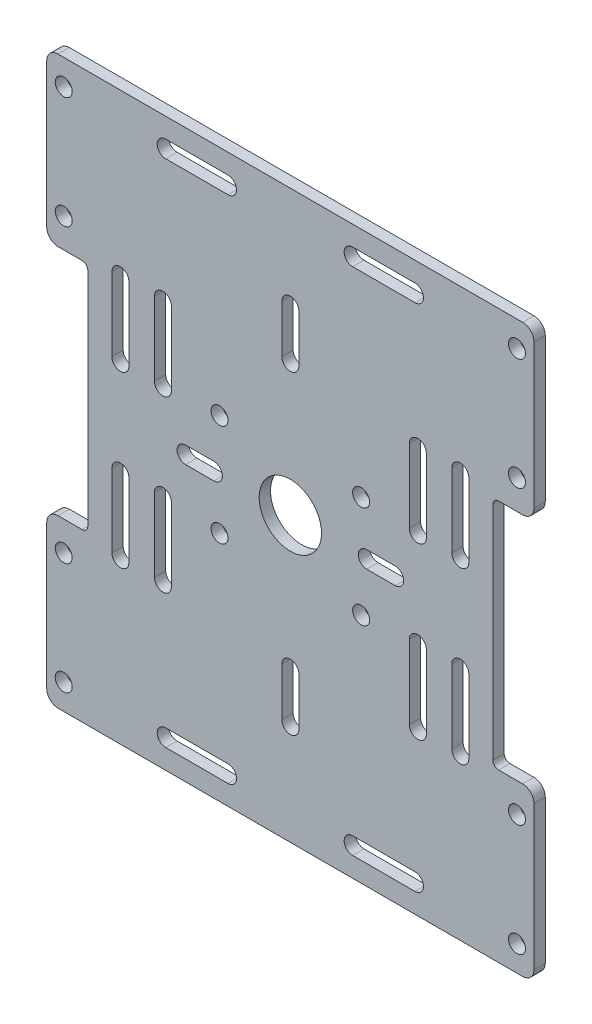
from build123d import *

# Parameters (mm, degrees)
SKETCH_1_R      = 5.5
SKETCH_1_R_2    = 1.5
EXTRUDE_1_DEPTH = 2
FILLET_1_R      = 1
FILLET_2_R      = 2


with BuildPart() as part:
    # 草圖1 → 填料-伸長1 (new body)
    with BuildSketch(Plane.XY):
        Polygon((-35.75, -20.56252042), (-43, -20.56252042), (-43, -50), (-25.75, -50), (25.75, -50), (43, -50), (43, -20.56252042), (35.75, -20.56252042), (35.75, 20.56252042), (43, 20.56252042), (43, 50), (25.75, 50), (-25.75, 50), (-43, 50), (-43, 20.56252042), (-35.75, 20.56252042), align=None)
        Circle(SKETCH_1_R, mode=Mode.SUBTRACT)
        with Locations((12.5, -9)):
            Circle(SKETCH_1_R_2, mode=Mode.SUBTRACT)
        with Locations((-12.5, -9)):
            Circle(SKETCH_1_R_2, mode=Mode.SUBTRACT)
        with Locations((12.5, 9)):
            Circle(SKETCH_1_R_2, mode=Mode.SUBTRACT)
        with Locations((-12.5, 9)):
            Circle(SKETCH_1_R_2, mode=Mode.SUBTRACT)
        with Locations((-40, -25.75)):
            Circle(SKETCH_1_R_2, mode=Mode.SUBTRACT)
        with Locations((40, -25.75)):
            Circle(SKETCH_1_R_2, mode=Mode.SUBTRACT)
        with Locations((40, 25.75)):
            Circle(SKETCH_1_R_2, mode=Mode.SUBTRACT)
        with Locations((-40, 25.75)):
            Circle(SKETCH_1_R_2, mode=Mode.SUBTRACT)
        with Locations((-40, -45.5)):
            Circle(SKETCH_1_R_2, mode=Mode.SUBTRACT)
        with Locations((-40, 45.5)):
            Circle(SKETCH_1_R_2, mode=Mode.SUBTRACT)
        with Locations((40, 45.5)):
            Circle(SKETCH_1_R_2, mode=Mode.SUBTRACT)
        with Locations((40, -45.5)):
            Circle(SKETCH_1_R_2, mode=Mode.SUBTRACT)
        with BuildLine():
            Line((13.5, 1.5), (18.5, 1.5))
            ThreePointArc((18.5, 1.5), (20, 0), (18.5, -1.5))
            Line((18.5, -1.5), (13.5, -1.5))
            ThreePointArc((13.5, -1.5), (12, 0), (13.5, 1.5))
        make_face(mode=Mode.SUBTRACT)
        with BuildLine():
            Line((24, -8.5), (24, -21.5))
            ThreePointArc((24, -21.5), (22.5, -23), (21, -21.5))
            Line((21, -21.5), (21, -8.5))
            ThreePointArc((21, -8.5), (22.5, -7), (24, -8.5))
        make_face(mode=Mode.SUBTRACT)
        with BuildLine():
            Line((31.5, -8.5), (31.5, -21.5))
            ThreePointArc((31.5, -21.5), (30, -23), (28.5, -21.5))
            Line((28.5, -21.5), (28.5, -8.5))
            ThreePointArc((28.5, -8.5), (30, -7), (31.5, -8.5))
        make_face(mode=Mode.SUBTRACT)
        with BuildLine():
            Line((31.5, 8.5), (31.5, 21.5))
            ThreePointArc((31.5, 21.5), (30, 23), (28.5, 21.5))
            Line((28.5, 21.5), (28.5, 8.5))
            ThreePointArc((28.5, 8.5), (30, 7), (31.5, 8.5))
        make_face(mode=Mode.SUBTRACT)
        with BuildLine():
            Line((24, 8.5), (24, 21.5))
            ThreePointArc((24, 21.5), (22.5, 23), (21, 21.5))
            Line((21, 21.5), (21, 8.5))
            ThreePointArc((21, 8.5), (22.5, 7), (24, 8.5))
        make_face(mode=Mode.SUBTRACT)
        with BuildLine():
            Line((-24, 8.5), (-24, 21.5))
            ThreePointArc((-24, 21.5), (-22.5, 23), (-21, 21.5))
            Line((-21, 21.5), (-21, 8.5))
            ThreePointArc((-21, 8.5), (-22.5, 7), (-24, 8.5))
        make_face(mode=Mode.SUBTRACT)
        with BuildLine():
            Line((-31.5, 8.5), (-31.5, 21.5))
            ThreePointArc((-31.5, 21.5), (-30, 23), (-28.5, 21.5))
            Line((-28.5, 21.5), (-28.5, 8.5))
            ThreePointArc((-28.5, 8.5), (-30, 7), (-31.5, 8.5))
        make_face(mode=Mode.SUBTRACT)
        with BuildLine():
            Line((-31.5, -8.5), (-31.5, -21.5))
            ThreePointArc((-31.5, -21.5), (-30, -23), (-28.5, -21.5))
            Line((-28.5, -21.5), (-28.5, -8.5))
            ThreePointArc((-28.5, -8.5), (-30, -7), (-31.5, -8.5))
        make_face(mode=Mode.SUBTRACT)
        with BuildLine():
            Line((-24, -8.5), (-24, -21.5))
            ThreePointArc((-24, -21.5), (-22.5, -23), (-21, -21.5))
            Line((-21, -21.5), (-21, -8.5))
            ThreePointArc((-21, -8.5), (-22.5, -7), (-24, -8.5))
        make_face(mode=Mode.SUBTRACT)
        with BuildLine():
            Line((-22, -43.5), (-11, -43.5))
            ThreePointArc((-11, -43.5), (-9.5, -45), (-11, -46.5))
            Line((-11, -46.5), (-22, -46.5))
            ThreePointArc((-22, -46.5), (-23.5, -45), (-22, -43.5))
        make_face(mode=Mode.SUBTRACT)
        with BuildLine():
            Line((22, -43.5), (11, -43.5))
            ThreePointArc((11, -43.5), (9.5, -45), (11, -46.5))
            Line((11, -46.5), (22, -46.5))
            ThreePointArc((22, -46.5), (23.5, -45), (22, -43.5))
        make_face(mode=Mode.SUBTRACT)
        with BuildLine():
            Line((22, 43.5), (11, 43.5))
            ThreePointArc((11, 43.5), (9.5, 45), (11, 46.5))
            Line((11, 46.5), (22, 46.5))
            ThreePointArc((22, 46.5), (23.5, 45), (22, 43.5))
        make_face(mode=Mode.SUBTRACT)
        with BuildLine():
            Line((-22, 43.5), (-11, 43.5))
            ThreePointArc((-11, 43.5), (-9.5, 45), (-11, 46.5))
            Line((-11, 46.5), (-22, 46.5))
            ThreePointArc((-22, 46.5), (-23.5, 45), (-22, 43.5))
        make_face(mode=Mode.SUBTRACT)
        with BuildLine():
            Line((-13.5, 1.5), (-18.5, 1.5))
            ThreePointArc((-18.5, 1.5), (-20, 0), (-18.5, -1.5))
            Line((-18.5, -1.5), (-13.5, -1.5))
            ThreePointArc((-13.5, -1.5), (-12, 0), (-13.5, 1.5))
        make_face(mode=Mode.SUBTRACT)
        with BuildLine():
            Line((1.5, -23.5), (1.5, -32))
            ThreePointArc((1.5, -32), (0, -33.5), (-1.5, -32))
            Line((-1.5, -32), (-1.5, -23.5))
            ThreePointArc((-1.5, -23.5), (0, -22), (1.5, -23.5))
        make_face(mode=Mode.SUBTRACT)
        with BuildLine():
            Line((1.5, 23.5), (1.5, 32))
            ThreePointArc((1.5, 32), (0, 33.5), (-1.5, 32))
            Line((-1.5, 32), (-1.5, 23.5))
            ThreePointArc((-1.5, 23.5), (0, 22), (1.5, 23.5))
        make_face(mode=Mode.SUBTRACT)
    extrude(amount=EXTRUDE_1_DEPTH)

    # 圓角1
    fillet_1_edges = [part.edges().sort_by_distance(p)[0] for p in [
        (35.75, -20.56252042, 1),
        (35.75, 20.56252042, 1),
        (-35.75, 20.56252042, 1),
        (-35.75, -20.56252042, 1),
    ]]
    fillet(fillet_1_edges, radius=FILLET_1_R)

    # 圓角2
    fillet_2_edges = [part.edges().sort_by_distance(p)[0] for p in [
        (43, 20.56252042, 1),
        (43, 50, 1),
        (-43, 50, 1),
        (-43, 20.56252042, 1),
        (-43, -20.56252042, 1),
        (-43, -50, 1),
        (43, -50, 1),
        (43, -20.56252042, 1),
    ]]
    fillet(fillet_2_edges, radius=FILLET_2_R)


solid = part.part
